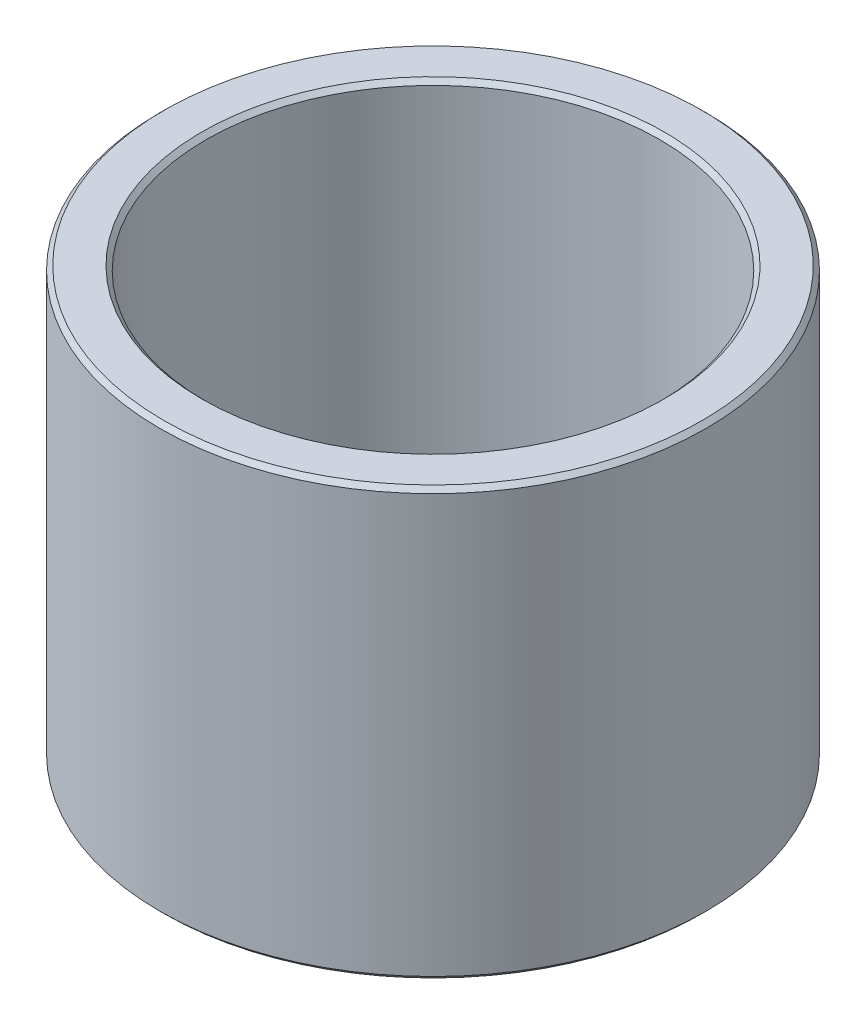
from build123d import *

# Parameters (mm, degrees)
SKETCH1_R           = 42.5
BOSS_EXTRUDE1_DEPTH = 66.392631385
SKETCH2_R           = 35.274859067
CUT_EXTRUDE1_DEPTH  = 90.557140989
CHAMFER1_SIZE       = 0.686489548


with BuildPart() as part:
    # Sketch1 → Boss-Extrude1 (new body)
    with BuildSketch(Plane(origin=(0, 0, 0), x_dir=(1, 0, 0), z_dir=(0, 1, 0))):
        Circle(SKETCH1_R)
    extrude(amount=BOSS_EXTRUDE1_DEPTH)

    # Sketch2 → Cut-Extrude1 (cut, through all)
    with BuildSketch(Plane(origin=(0, 0, 0), x_dir=(1, 0, 0), z_dir=(0, 1, 0))):
        Circle(SKETCH2_R)
    extrude(amount=CUT_EXTRUDE1_DEPTH, mode=Mode.SUBTRACT)

    # Chamfer1
    chamfer1_edges = [part.edges().sort_by_distance(p)[0] for p in [
        (-35.274859067, 66.392631385, 0),
        (-35.274859067, 0, 0),
        (-42.5, 0, 0),
        (-42.5, 66.392631385, 0),
    ]]
    chamfer(chamfer1_edges, length=CHAMFER1_SIZE)


solid = part.part
